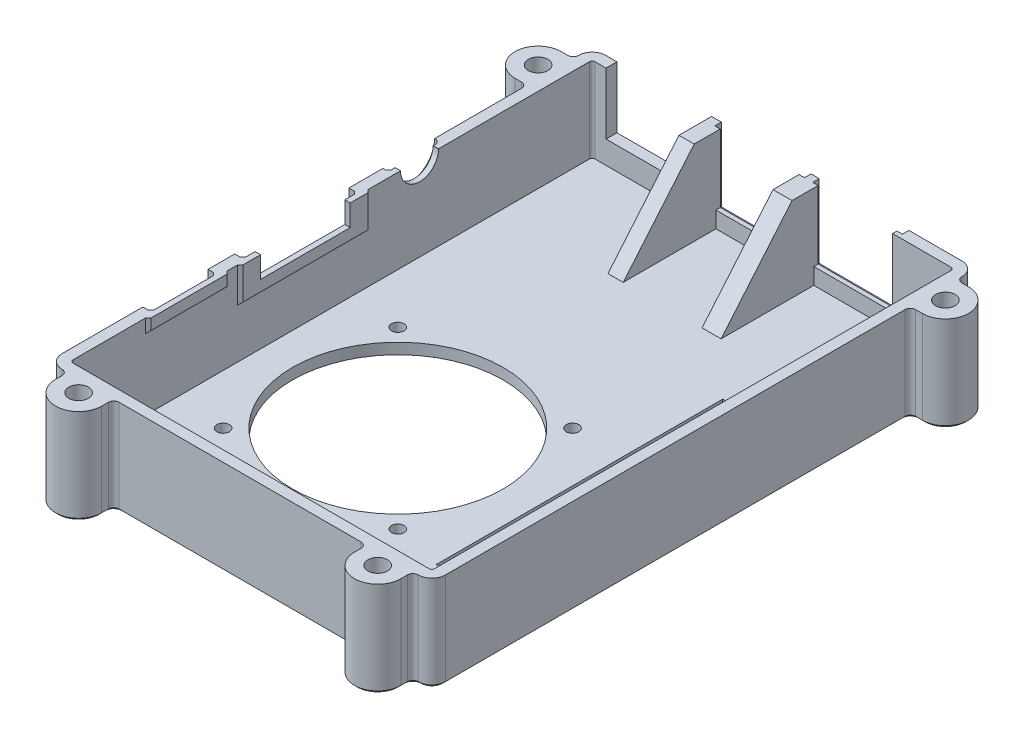
from build123d import *

# Parameters (mm, degrees)
BASE_DEPTH                      = 17.5
SHELL_T                         = -2
CLAMPS_DEPTH                    = 17.5
CLAMP_FILLETS_R                 = 1
SKETCH20_R                      = 1.8
CLAMP_HOLES_DEPTH               = 128.387411073
SKETCH21_R                      = 2.9
CLAMP_COUNTERSINKS_DEPTH        = 3.4
CLAMP_COUNTERSINK_CHAMFERS_SIZE = 0.3
SKETCH24_W                      = 14.5
SKETCH24_H                      = 12.5
USB_CUTOUT_DEPTH                = 18.25
SKETCH25_W                      = 16.5
SKETCH25_H                      = 13.5
USB_APPROACH_DEPTH              = 1.2
USB_INNER_SUPPORT_DEPTH         = 3.5
USB_OUTER_SUPPORT_DEPTH         = 2.8
SKETCH28_W                      = 17.4
SKETCH28_H                      = 11.3
RJ45_CUTOUT_DEPTH               = 22.7
SKETCH29_W                      = 15
SKETCH29_H                      = 2.5
SKETCH29_W_2                    = 24
SKETCH29_H_2                    = 6.43
HDMI_SUPPORT_DEPTH              = 0.5
HDMI_SUPPORT_CHAMFER_SIZE       = 0.5
SKETCH30_W                      = 21
SKETCH30_H                      = 5.93
SKETCH30_W_2                    = 12
SKETCH30_H_2                    = 2
HDMI_APPROACH_DEPTH             = 1.5
SKETCH31_W                      = 16.5
SKETCH31_H                      = 3.93
HDMI_CUTOUT_DEPTH               = 1
HDMI_APPROACH_CHAMFER_SIZE      = 0.5
SKETCH32_R                      = 3.5
AUDIO_CUTOUT_DEPTH              = 2
SKETCH33_R                      = 4.75
AUDIO_APPROACH_DEPTH            = 1
AUDIO_APPROACH_CHAMFER_SIZE     = 0.5
SKETCH34_W                      = 6
SKETCH34_H                      = 52.7
HEADER_CUTOUT_DEPTH             = 2
HEADER_COVER_DEPTH              = 1
SHELL_CHAMFER_SIZE              = 0.5
SKETCH39_R                      = 19.37
SKETCH39_R_2                    = 1.15
FAN_MOUNT_DEPTH                 = 2


with BuildPart() as part:
    # Sketch2 → Base (new body)
    with BuildSketch(Plane(origin=(0, 0, 0), x_dir=(1, 0, 0), z_dir=(0, 1, 0))):
        with BuildLine():
            Line((2.5, 0), (68, 0))
            ThreePointArc((68, 0), (69.767766953, 0.732233047), (70.5, 2.5))
            Line((70.5, 2.5), (70.5, 97.5))
            ThreePointArc((70.5, 97.5), (69.767766953, 99.267766953), (68, 100))
            Line((68, 100), (2.5, 100))
            ThreePointArc((2.5, 100), (0.732233047, 99.267766953), (0, 97.5))
            Line((0, 97.5), (0, 2.5))
            ThreePointArc((0, 2.5), (0.732233047, 0.732233047), (2.5, 0))
        make_face()
    extrude(amount=BASE_DEPTH)

    # Shell
    shell_openings = [part.faces().sort_by_distance(p)[0] for p in [
        (35.25, 17.5, -50),
    ]]
    offset(amount=SHELL_T, openings=shell_openings, kind=Kind.INTERSECTION)

    # Sketch14 → Clamps (add)
    with BuildSketch(Plane.XZ):
        with BuildLine():
            Line((-2.2, -88), (0, -88))
            Line((0, -88), (0, -96.5))
            Line((0, -96.5), (-2.2, -96.5))
            ThreePointArc((-2.2, -96.5), (-6.45, -92.25), (-2.2, -88))
        make_face()
        with BuildLine():
            Line((3.5, 2.2), (3.5, 0))
            Line((3.5, 0), (12, 0))
            Line((12, 0), (12, 2.2))
            ThreePointArc((12, 2.2), (7.75, 6.45), (3.5, 2.2))
        make_face()
        with BuildLine():
            Line((72.7, -88), (70.5, -88))
            Line((70.5, -88), (70.5, -96.5))
            Line((70.5, -96.5), (72.7, -96.5))
            ThreePointArc((72.7, -96.5), (76.95, -92.25), (72.7, -88))
        make_face()
        with BuildLine():
            Line((58.5, 0), (58.5, 2.2))
            ThreePointArc((58.5, 2.2), (62.75, 6.45), (67, 2.2))
            Line((67, 2.2), (67, 0))
            Line((67, 0), (58.5, 0))
        make_face()
    extrude(amount=-CLAMPS_DEPTH)

    # Clamp Fillets
    clamp_fillets_edges = [part.edges().sort_by_distance(p)[0] for p in [
        (0, 8.75, -96.5),
        (0, 8.75, -88),
        (3.5, 8.75, 0),
        (12, 8.75, 0),
        (70.5, 8.75, -88),
        (70.5, 8.75, -96.5),
        (58.5, 8.75, 0),
        (67, 8.75, 0),
    ]]
    fillet(clamp_fillets_edges, radius=CLAMP_FILLETS_R - 0.0001)  # a hair under: the kernel refuses the full size

    # Sketch20 → Clamp Holes (cut, through all)
    with BuildSketch(Plane.XZ):
        with Locations(Location((7.75, 2.2, 0), (0, 0, 270))):
            Circle(SKETCH20_R)
        with Locations(Location((62.75, 2.2, 0), (0, 0, 270))):
            Circle(SKETCH20_R)
        with Locations(Location((72.7, -92.25, 0), (0, 0, 270))):
            Circle(SKETCH20_R)
        with Locations(Location((-2.2, -92.25, 0), (0, 0, 270))):
            Circle(SKETCH20_R)
    extrude(amount=-CLAMP_HOLES_DEPTH, mode=Mode.SUBTRACT)

    # Sketch21 → Clamp Countersinks (cut)
    with BuildSketch(Plane.XZ):
        with Locations(Location((7.75, 2.2, 0), (0, 0, 270))):
            Circle(SKETCH21_R)
        with Locations(Location((62.75, 2.2, 0), (0, 0, 270))):
            Circle(SKETCH21_R)
        with Locations(Location((72.7, -92.25, 0), (0, 0, 270))):
            Circle(SKETCH21_R)
        with Locations(Location((-2.2, -92.25, 0), (0, 0, 270))):
            Circle(SKETCH21_R)
    extrude(amount=-CLAMP_COUNTERSINKS_DEPTH, mode=Mode.SUBTRACT)

    # Clamp Countersink Chamfers
    clamp_countersink_chamfers_edges = [part.edges().sort_by_distance(p)[0] for p in [
        (-2.2, 0, -89.35),
        (72.7, 0, -89.35),
        (62.75, 0, 5.1),
        (7.75, 0, 5.1),
    ]]
    chamfer(clamp_countersink_chamfers_edges, length=CLAMP_COUNTERSINK_CHAMFERS_SIZE)

    # Sketch24 → USB Cutout (cut)
    with BuildSketch(Plane(origin=(0, 0, -100), x_dir=(-1, 0, 0), z_dir=(0, 0, -1))):
        with Locations((-50, 11.25)):
            Rectangle(SKETCH24_W, SKETCH24_H)
        with Locations((-32, 11.25)):
            Rectangle(SKETCH24_W, SKETCH24_H)
    extrude(amount=-USB_CUTOUT_DEPTH, mode=Mode.SUBTRACT)

    # Sketch25 → USB Approach (cut)
    with BuildSketch(Plane(origin=(0, 0, -100), x_dir=(-1, 0, 0), z_dir=(0, 0, -1))):
        with Locations((-50, 10.75)):
            Rectangle(SKETCH25_W, SKETCH25_H)
        with Locations((-32, 10.75)):
            Rectangle(SKETCH25_W, SKETCH25_H)
    extrude(amount=-USB_APPROACH_DEPTH, mode=Mode.SUBTRACT)

    # Sketch26 → USB Inner Support (add)
    with BuildSketch(Plane(origin=(42.75, 0, 0), x_dir=(0, 0, -1), z_dir=(1, 0, 0))):
        Polygon((98, 2), (98, 17.5), (94, 17.5), (80.95, 2), align=None)
    extrude(amount=-USB_INNER_SUPPORT_DEPTH)

    # Sketch27 → USB Outer Support (add)
    with BuildSketch(Plane(origin=(24.75, 0, 0), x_dir=(0, 0, -1), z_dir=(1, 0, 0))):
        Polygon((98, 2), (98, 17.5), (94, 17.5), (80.95, 2), align=None)
    extrude(amount=-USB_OUTER_SUPPORT_DEPTH)

    # Sketch28 → RJ45 Cutout (cut)
    with BuildSketch(Plane(origin=(0, 0, -100), x_dir=(-1, 0, 0), z_dir=(0, 0, -1))):
        with Locations((-13.25, 11.85)):
            Rectangle(SKETCH28_W, SKETCH28_H)
    extrude(amount=-RJ45_CUTOUT_DEPTH, mode=Mode.SUBTRACT)

    # Sketch29 → HDMI Support (add)
    with BuildSketch(Plane(origin=(2, 0, 0), x_dir=(0, 0, -1), z_dir=(1, 0, 0))):
        with Locations((23.35, 16.25)):
            Rectangle(SKETCH29_W, SKETCH29_H)
        with Locations((44.75, 14.285)):
            Rectangle(SKETCH29_W_2, SKETCH29_H_2)
    extrude(amount=HDMI_SUPPORT_DEPTH)

    # HDMI Support Chamfer
    hdmi_support_chamfer_edges = [part.edges().sort_by_distance(p)[0] for p in [
        (2.5, 14.285, -56.75),
        (2.5, 11.07, -44.75),
        (2.5, 14.285, -32.75),
        (2.5, 16.25, -30.85),
        (2.5, 15, -23.35),
        (2.5, 16.25, -15.85),
    ]]
    chamfer(hdmi_support_chamfer_edges, length=HDMI_SUPPORT_CHAMFER_SIZE - 0.0001)  # a hair under: the kernel refuses the full size

    # Sketch30 → HDMI Approach (cut)
    with BuildSketch(Plane.ZY):
        with Locations((-44.75, 14.535)):
            Rectangle(SKETCH30_W, SKETCH30_H)
        with Locations((-23.35, 16.5)):
            Rectangle(SKETCH30_W_2, SKETCH30_H_2)
    extrude(amount=-HDMI_APPROACH_DEPTH, mode=Mode.SUBTRACT)

    # Sketch31 → HDMI Cutout (cut)
    with BuildSketch(Plane.ZY.offset(-1.5)):
        with Locations((-44.75, 15.535)):
            Rectangle(SKETCH31_W, SKETCH31_H)
    extrude(amount=-HDMI_CUTOUT_DEPTH, mode=Mode.SUBTRACT)

    # HDMI Approach Chamfer
    hdmi_approach_chamfer_edges = [part.edges().sort_by_distance(p)[0] for p in [
        (1.5, 14.535, -34.25),
        (1.5, 11.57, -44.75),
        (1.5, 14.535, -55.25),
        (1.5, 16.5, -29.35),
        (1.5, 16.5, -17.35),
        (1.5, 15.5, -23.35),
    ]]
    chamfer(hdmi_approach_chamfer_edges, length=HDMI_APPROACH_CHAMFER_SIZE)

    # Sketch32 → Audio Cutout (cut)
    with BuildSketch(Plane.ZY):
        with Locations((-66.25, 17.5)):
            Circle(SKETCH32_R)
    extrude(amount=-AUDIO_CUTOUT_DEPTH, mode=Mode.SUBTRACT)

    # Sketch33 → Audio Approach (cut)
    with BuildSketch(Plane.ZY):
        with Locations((-66.25, 17.5)):
            Circle(SKETCH33_R)
    extrude(amount=-AUDIO_APPROACH_DEPTH, mode=Mode.SUBTRACT)

    # Audio Approach Chamfer
    audio_approach_chamfer_edges = [part.edges().sort_by_distance(p)[0] for p in [
        (1, 12.75, -66.25),
    ]]
    chamfer(audio_approach_chamfer_edges, length=AUDIO_APPROACH_CHAMFER_SIZE)

    # Sketch34 → Header Cutout (cut)
    with BuildSketch(Plane.XZ):
        with Locations((55.5, -45.15)):
            Rectangle(SKETCH34_W, SKETCH34_H)
    extrude(amount=-HEADER_CUTOUT_DEPTH, mode=Mode.SUBTRACT)

    # Sketch35 → Header Cover (add)
    with BuildSketch(Plane.XZ):
        Polygon((56, -18.8), (55, -18.8), (55, -19.8), (53.5, -19.8), (53.5, -24.7625), (52.5, -24.7625), (52.5, -25.7625), (53.5, -25.7625), (53.5, -37.6875), (52.5, -37.6875), (52.5, -38.6875), (53.5, -38.6875), (53.5, -43.65), (55, -43.65), (55, -44.65), (52.5, -44.65), (52.5, -45.65), (55, -45.65), (55, -46.65), (53.5, -46.65), (53.5, -51.6125), (52.5, -51.6125), (52.5, -52.6125), (53.5, -52.6125), (53.5, -64.5375), (52.5, -64.5375), (52.5, -65.5375), (53.5, -65.5375), (53.5, -70.5), (55, -70.5), (55, -71.5), (56, -71.5), (56, -70.5), (57.5, -70.5), (57.5, -65.5375), (58.5, -65.5375), (58.5, -64.5375), (57.5, -64.5375), (57.5, -52.6125), (58.5, -52.6125), (58.5, -51.6125), (57.5, -51.6125), (57.5, -46.65), (56, -46.65), (56, -45.65), (58.5, -45.65), (58.5, -44.65), (56, -44.65), (56, -43.65), (57.5, -43.65), (57.5, -38.6875), (58.5, -38.6875), (58.5, -37.6875), (57.5, -37.6875), (57.5, -25.7625), (58.5, -25.7625), (58.5, -24.7625), (57.5, -24.7625), (57.5, -19.8), (56, -19.8), align=None)
    extrude(amount=-HEADER_COVER_DEPTH)

    # Shell Chamfer
    shell_chamfer_edges = [part.edges().sort_by_distance(p)[0] for p in [
        (-1.59995, 0, -88),
        (72.09995, 0, -96.5),
        (58.207136071, 0, 0.292863929),
        (0.732233047, 0, -0.732233047),
        (67.292863929, 0, 0.292863929),
        (12.292863929, 0, 0.292863929),
        (3.207136071, 0, 0.292863929),
        (-0.292863929, 0, -96.792863929),
        (-0.292863929, 0, -87.707136071),
        (70.792863929, 0, -87.707136071),
        (70.792863929, 0, -96.792863929),
        (-6.45, 0, -92.25),
        (-1.59995, 0, -96.5),
        (52.5, 0, -21.78125),
        (53.75, 0, -71.5),
        (58.5, 0, -68.51875),
        (57.25, 0, -18.8),
        (57.25, 0, -71.5),
        (58.5, 0, -58.575),
        (58.5, 0, -48.63125),
        (58.5, 0, -41.66875),
        (58.5, 0, -31.725),
        (58.5, 0, -21.78125),
        (53.75, 0, -18.8),
        (52.5, 0, -31.725),
        (52.5, 0, -41.66875),
        (52.5, 0, -48.63125),
        (52.5, 0, -58.575),
        (52.5, 0, -68.51875),
        (7.75, 0, 6.45),
        (3.5, 0, 1.59995),
        (76.95, 0, -92.25),
        (72.09995, 0, -88),
        (62.75, 0, 6.45),
        (58.5, 0, 1.59995),
        (0.732233047, 0, -99.267766953),
        (35.25, 0, -100),
        (69.767766953, 0, -99.267766953),
        (35.25, 0, 0),
        (70.5, 0, -44.75005),
        (67, 0, 1.59995),
        (12, 0, 1.59995),
        (69.767766953, 0, -0.732233047),
        (0, 0, -44.75005),
    ]]
    chamfer(shell_chamfer_edges, length=SHELL_CHAMFER_SIZE)

    # Sketch39 → Fan Mount (cut)
    with BuildSketch(Plane.XZ):
        with Locations(Location((27.25, -37, 0), (0, 0, 270))):
            Circle(SKETCH39_R)
        with Locations(Location((43.315466069, -20.934533931, 0), (0, 0, 270))):
            Circle(SKETCH39_R_2)
        with Locations(Location((43.315466069, -53.065466069, 0), (0, 0, 90))):
            Circle(SKETCH39_R_2)
        with Locations(Location((11.184533931, -53.065466069, 0), (0, 0, 270))):
            Circle(SKETCH39_R_2)
        with Locations(Location((11.184533931, -20.934533931, 0), (0, 0, 90))):
            Circle(SKETCH39_R_2)
    extrude(amount=-FAN_MOUNT_DEPTH, mode=Mode.SUBTRACT)


solid = part.part
